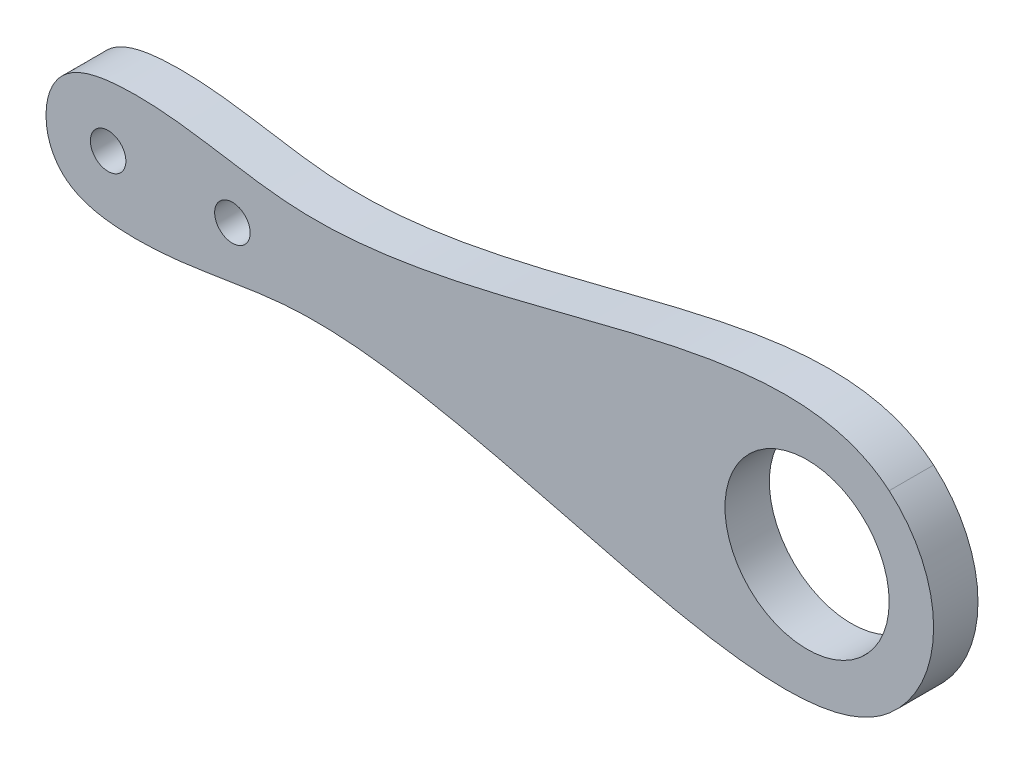
from build123d import *
from build123d.topology import SkipClean

# Parameters (mm, degrees)
BOSS_EXTRUDE1_DEPTH = 10


with BuildPart() as part:
    # Sketch1 → Boss-Extrude1 (new body)
    with BuildSketch(Plane(origin=(0, 0, 0), x_dir=(-1, 0, 0), z_dir=(0, 0, 1))):
        with BuildLine():
            Line((0, 0), (10.014962741, 0))
            ThreePointArc((10.014962741, 0), (28.514962741, 18.5), (47.014962741, 0))
            Line((47.014962741, 0), (154, 0))
            ThreePointArc((154, 0), (158, 4), (162, 0))
            Line((162, 0), (182, 0))
            ThreePointArc((182, 0), (186, 4), (190, 0))
            Line((190, 0), (200, 0))
            add(Edge.make_bspline(
                [(10.014962741, 21.699149756), (35.618249994, 43.527692326), (116.100259813, -2.68087318), (172.967502722, 15.928238399), (196.322400778, 12.416133913), (200, 4.178063308), (200, 0)],
                knots=[0, 0, 0, 0, 0.679548857, 0.872608506, 0.945194487, 1, 1, 1, 1], degree=3))
            ThreePointArc((10.014962741, 21.699149756), (2.62452135, 11.949399345), (0, 0))
        make_face()
    boss_extrude1 = extrude(amount=BOSS_EXTRUDE1_DEPTH)

    # Mirror1: Boss-Extrude1 across plane
    with SkipClean():  # the faces are left unmerged after this step: merging them gives an invalid solid
        add(boss_extrude1.mirror(Plane(origin=(-47.014962741, 0, 10), x_dir=(0, 0, 1), z_dir=(0, -1, 0))))


solid = part.part
